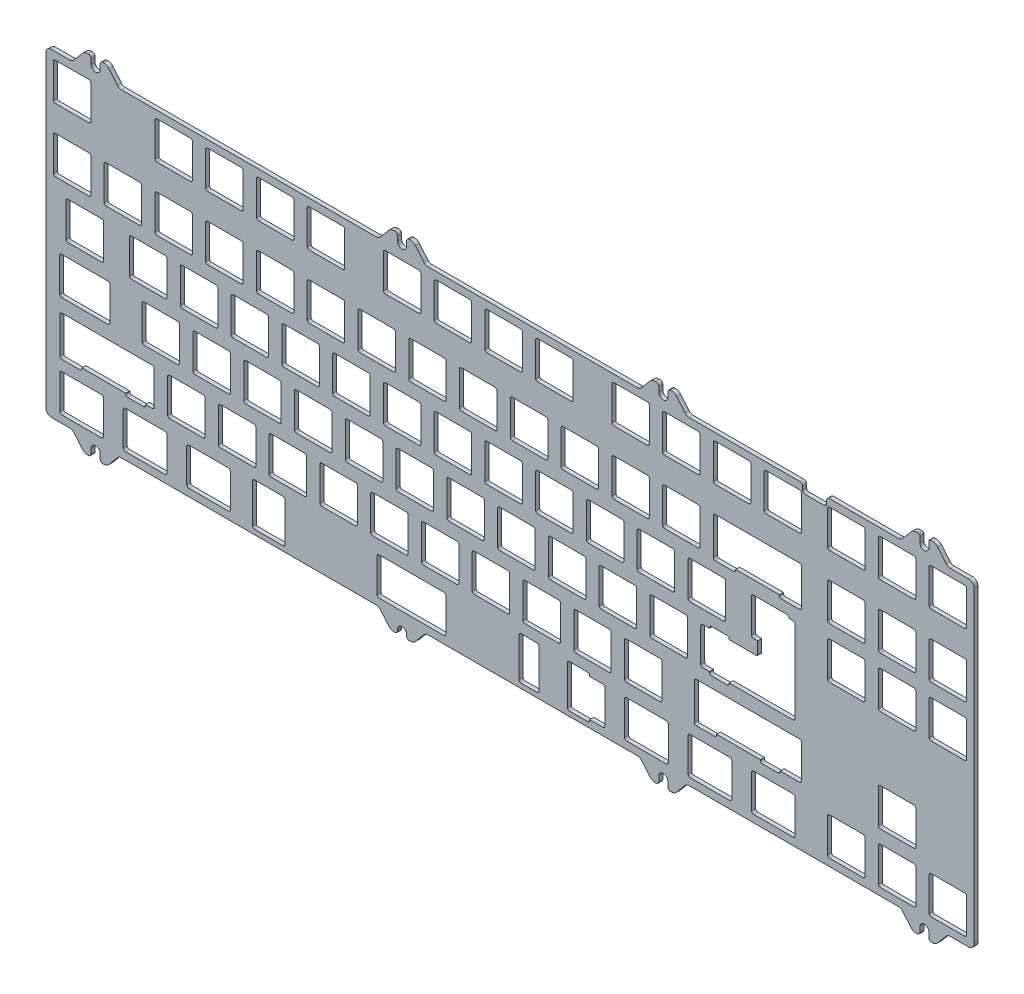
from build123d import *

# Parameters (mm, degrees)
EXTRUDE_1_DEPTH = 1.5


with BuildPart() as part:
    # 스케치1 → 보스-돌출1 (new body)
    with BuildSketch(Plane.XY):
        with BuildLine():
            Line((231.532778374, -109.812504455), (310.071896545, -109.812504455))
            ThreePointArc((310.071896545, -109.812504455), (310.917129792, -109.999890341), (311.603979435, -110.526929506))
            Line((311.603979435, -110.526929506), (314.786296701, -114.319471173))
            ThreePointArc((314.786296701, -114.319471173), (315.644863565, -114.978274877), (316.701412124, -115.212506643))
            Line((316.701412124, -115.212506643), (317.079660645, -115.212506643))
            ThreePointArc((317.079660645, -115.212506643), (317.786768112, -114.919612822), (318.079660846, -114.212504904))
            Line((318.079660846, -114.212504904), (318.079660846, -112.412504237))
            ThreePointArc((318.079660846, -112.412504237), (319.77965982, -110.712506364), (321.479658795, -112.412504237))
            Line((321.479658795, -112.412504237), (321.479660444, -114.212506442))
            ThreePointArc((321.479660444, -114.212506442), (321.772553662, -114.919613223), (322.479660444, -115.212506442))
            Line((322.479660444, -115.212506442), (322.857908964, -115.212506442))
            ThreePointArc((322.857908964, -115.212506442), (323.914454618, -114.97827591), (324.773020072, -114.319475466))
            Line((324.773020072, -114.319475466), (327.955342548, -110.526931223))
            ThreePointArc((327.955342548, -110.526931223), (328.64219491, -109.999890868), (329.487431434, -109.812506442))
            Line((329.487431434, -109.812506442), (336.412510444, -109.812506442))
            ThreePointArc((336.412510444, -109.812506442), (337.82672103, -109.226721627), (338.412507177, -107.812511592))
            Line((338.412507177, -107.812511592), (338.412507177, 7.799989687))
            ThreePointArc((338.412507177, 7.799989687), (337.826723914, 9.214210914), (336.412504524, 9.799998613))
            Line((336.412504524, 9.799998613), (329.487425514, 9.799998613))
            ThreePointArc((329.487425514, 9.799998613), (328.642188991, 9.987383039), (327.955336628, 10.514423393))
            Line((327.955336628, 10.514423393), (324.773014152, 14.306967637))
            ThreePointArc((324.773014152, 14.306967637), (323.914448699, 14.96576808), (322.857903044, 15.199998613))
            Line((322.857903044, 15.199998613), (321.979654524, 15.199998613))
            ThreePointArc((321.979654524, 15.199998613), (321.626100422, 15.053551634), (321.4796537, 14.699997425))
            Line((321.4796537, 14.699997425), (321.4796537, 12.399997607))
            ThreePointArc((321.4796537, 12.399997607), (319.779654725, 10.699171768), (318.07965575, 12.399997606))
            Line((318.07965575, 12.399997606), (318.07965575, 14.699997424))
            ThreePointArc((318.07965575, 14.699997424), (317.933211586, 15.053548674), (317.579662328, 15.199997647))
            Line((317.579662328, 15.199997647), (316.701406969, 15.199997929))
            ThreePointArc((316.701406969, 15.199997929), (315.644861314, 14.965767396), (314.786295861, 14.306966953))
            Line((314.786295861, 14.306966953), (311.603973385, 10.514422709))
            ThreePointArc((311.603973385, 10.514422709), (310.91712393, 9.987383689), (310.071890913, 9.799997853))
            Line((310.071890913, 9.799997853), (284.106259905, 9.799997853))
            ThreePointArc((284.106259905, 9.799997853), (283.399150314, 9.507106315), (283.106255538, 8.799998064))
            Line((283.106255538, 8.799998064), (283.106255538, 7.599998064))
            ThreePointArc((283.106255538, 7.599998064), (282.813362441, 6.892891586), (282.106256063, 6.599998246))
            Line((282.106256063, 6.599998246), (275.106256778, 6.599998246))
            ThreePointArc((275.106256778, 6.599998246), (274.39914926, 6.892891), (274.106255629, 7.599998155))
            Line((274.106255629, 7.599998155), (274.106255629, 8.799998155))
            ThreePointArc((274.106255629, 8.799998155), (273.813361477, 9.507105782), (273.106253027, 9.799997944))
            Line((273.106253027, 9.799997944), (231.532773255, 9.799997944))
            ThreePointArc((231.532773255, 9.799997944), (230.687538598, 9.987383145), (230.000687783, 10.5144228))
            Line((230.000687783, 10.5144228), (226.818365307, 14.306967044))
            ThreePointArc((226.818365307, 14.306967044), (225.959799853, 14.965767487), (224.903254199, 15.19999802))
            Line((224.903254199, 15.19999802), (224.525005678, 15.19999802))
            ThreePointArc((224.525005678, 15.19999802), (223.817898897, 14.907104801), (223.525005678, 14.19999802))
            Line((223.525005678, 14.19999802), (223.525008277, 12.399997838))
            ThreePointArc((223.525008277, 12.399997838), (221.825009302, 10.699999045), (220.125010328, 12.399997838))
            Line((220.125010328, 12.399997838), (220.125005678, 14.19999802))
            ThreePointArc((220.125005678, 14.19999802), (219.832113428, 14.907103774), (219.125008442, 15.199997879))
            Line((219.125008442, 15.199997879), (218.746757366, 15.199997879))
            ThreePointArc((218.746757366, 15.199997879), (217.690211712, 14.965767488), (216.831646191, 14.306967185))
            Line((216.831646191, 14.306967185), (213.649323715, 10.514422941))
            ThreePointArc((213.649323715, 10.514422941), (212.962469432, 9.987381669), (212.117230589, 9.799998085))
            Line((212.117230589, 9.799998085), (133.532783086, 9.799998085))
            ThreePointArc((133.532783086, 9.799998085), (132.687542953, 9.98738117), (132.0006876, 10.514422941))
            Line((132.0006876, 10.514422941), (128.818365124, 14.306967185))
            ThreePointArc((128.818365124, 14.306967185), (127.959800758, 14.965767106), (126.903256418, 15.19999811))
            Line((126.903256418, 15.19999811), (126.525005604, 15.199998392))
            ThreePointArc((126.525005604, 15.199998392), (125.817897856, 14.90710468), (125.52500446, 14.199996802))
            Line((125.52500446, 14.199996802), (125.525006749, 12.399997247))
            ThreePointArc((125.525006749, 12.399997247), (123.825006749, 10.699997247), (122.125006749, 12.399997247))
            Line((122.125006749, 12.399997247), (122.12500651, 14.199996802))
            ThreePointArc((122.12500651, 14.199996802), (121.832112774, 14.907104488), (121.125004624, 15.199997107))
            Line((121.125004624, 15.199997107), (120.746758369, 15.199997388))
            ThreePointArc((120.746758369, 15.199997388), (119.690212715, 14.965766856), (118.831647261, 14.306966412))
            Line((118.831647261, 14.306966412), (115.649324785, 10.514422169))
            ThreePointArc((115.649324785, 10.514422169), (114.962471664, 9.987381438), (114.117234223, 9.799997313))
            Line((114.117234223, 9.799997313), (18.540612817, 9.799997313))
            ThreePointArc((18.540612817, 9.799997313), (17.695376293, 9.987381739), (17.008523931, 10.514422093))
            Line((17.008523931, 10.514422093), (13.826201878, 14.306966716))
            ThreePointArc((13.826201878, 14.306966716), (12.967636378, 14.965766936), (11.91109078, 15.199997263))
            Line((11.91109078, 15.199997263), (11.532841567, 15.199997263))
            ThreePointArc((11.532841567, 15.199997263), (10.825735107, 14.907103914), (10.532842134, 14.199997298))
            Line((10.532842134, 14.199997298), (10.532841735, 12.399997744))
            ThreePointArc((10.532841735, 12.399997744), (8.832841886, 10.699542788), (7.132841856, 12.399997562))
            Line((7.132841856, 12.399997562), (7.132841856, 14.199997298))
            ThreePointArc((7.132841856, 14.199997298), (6.839948752, 14.907104411), (6.132841735, 15.199997744))
            Line((6.132841735, 15.199997744), (5.754593411, 15.199997462))
            ThreePointArc((5.754593411, 15.199997462), (4.698047686, 14.965767099), (3.839482107, 14.306966768))
            Line((3.839482107, 14.306966768), (0.657159631, 10.514422525))
            ThreePointArc((0.657159631, 10.514422525), (-0.029692672, 9.987381941), (-0.874929246, 9.799997322))
            Line((-0.874929246, 9.799997322), (-7.800008054, 9.799997322))
            ThreePointArc((-7.800008054, 9.799997322), (-9.214221604, 9.214211109), (-9.800008265, 7.799997744))
            Line((-9.800008265, 7.799997744), (-9.800008265, -107.812503353))
            ThreePointArc((-9.800008265, -107.812503353), (-9.214221292, -109.226715278), (-7.800008753, -109.81250077))
            Line((-7.800008753, -109.81250077), (-0.874929954, -109.812502284))
            ThreePointArc((-0.874929954, -109.812502284), (-0.029693431, -109.99988671), (0.657158932, -110.526927065))
            Line((0.657158932, -110.526927065), (3.839481408, -114.319471309))
            ThreePointArc((3.839481408, -114.319471309), (4.698046885, -114.978272061), (5.754592712, -115.212502773))
            Line((5.754592712, -115.212502773), (6.132840994, -115.212502773))
            ThreePointArc((6.132840994, -115.212502773), (6.839947975, -114.919609396), (7.132841036, -114.212502284))
            Line((7.132841036, -114.212502284), (7.132841158, -112.412500079))
            ThreePointArc((7.132841158, -112.412500079), (8.832841297, -110.712501033), (10.532841435, -112.412500079))
            Line((10.532841435, -112.412500079), (10.532841435, -114.212500747))
            ThreePointArc((10.532841435, -114.212500747), (10.825733749, -114.919608566), (11.532840868, -115.212502573))
            Line((11.532840868, -115.212502573), (11.911090081, -115.212502573))
            ThreePointArc((11.911090081, -115.212502573), (12.967636359, -114.978271339), (13.826201797, -114.319469626))
            Line((13.826201797, -114.319469626), (17.00852385, -110.526927959))
            ThreePointArc((17.00852385, -110.526927959), (17.695376388, -109.999887444), (18.540613129, -109.812502908))
            Line((18.540613129, -109.812502908), (114.117234721, -109.812502908))
            ThreePointArc((114.117234721, -109.812502908), (114.962472393, -109.999887085), (115.649325702, -110.526927959))
            Line((115.649325702, -110.526927959), (118.831649779, -114.319469626))
            ThreePointArc((118.831649779, -114.319469626), (119.690216192, -114.978270834), (120.746763207, -115.212500898))
            Line((120.746763207, -115.212500898), (121.125006833, -115.212500898))
            ThreePointArc((121.125006833, -115.212500898), (121.83211571, -114.9196079), (122.125009223, -114.212499235))
            Line((122.125009223, -114.212499235), (122.125009461, -113.712500773))
            ThreePointArc((122.125009461, -113.712500773), (123.825009461, -112.012500773), (125.525009461, -113.712500773))
            Line((125.525009461, -113.712500773), (125.525007172, -114.212499235))
            ThreePointArc((125.525007172, -114.212499235), (125.817899917, -114.919608043), (126.525008055, -115.212502406))
            Line((126.525008055, -115.212502406), (126.90325913, -115.212502406))
            ThreePointArc((126.90325913, -115.212502406), (127.959805684, -114.978270456), (128.818371114, -114.319468036))
            Line((128.818371114, -114.319468036), (132.000690267, -110.526926369))
            ThreePointArc((132.000690267, -110.526926369), (132.687545808, -109.999884454), (133.532786172, -109.812501318))
            Line((133.532786172, -109.812501318), (212.117233675, -109.812501318))
            ThreePointArc((212.117233675, -109.812501318), (212.962472748, -109.999884953), (213.649327219, -110.526926369))
            Line((213.649327219, -110.526926369), (216.831648732, -114.319468036))
            ThreePointArc((216.831648732, -114.319468036), (217.690214485, -114.978270078), (218.746761222, -115.212501323))
            Line((218.746761222, -115.212501323), (219.125012297, -115.212501323))
            ThreePointArc((219.125012297, -115.212501323), (219.832119743, -114.91960588), (220.125012244, -114.212497216))
            Line((220.125012244, -114.212497216), (220.125012244, -112.412496548))
            ThreePointArc((220.125012244, -112.412496548), (221.825011219, -110.712499779), (223.525010193, -112.412496548))
            Line((223.525010193, -112.412496548), (223.525007595, -114.212498754))
            ThreePointArc((223.525007595, -114.212498754), (223.817900813, -114.919605535), (224.525007595, -115.212498754))
            Line((224.525007595, -115.212498754), (224.903263296, -115.212499242))
            ThreePointArc((224.903263296, -115.212499242), (225.959802639, -114.978267979), (226.818363317, -114.319471173))
            Line((226.818363317, -114.319471173), (230.000692483, -110.526929506))
            ThreePointArc((230.000692483, -110.526929506), (230.687543486, -109.999889707), (231.532778374, -109.812504455))
        make_face()
        with BuildLine():
            Line((241.33, -16.7825), (273.02, -16.7825))
            ThreePointArc((273.02, -16.7825), (273.514974747, -16.987525253), (273.72, -17.4825))
            Line((273.72, -17.4825), (273.72, -31.1325))
            ThreePointArc((273.72, -31.1325), (273.514974747, -31.627474747), (273.02, -31.8325))
            Line((273.02, -31.8325), (266.11305, -31.8325))
            ThreePointArc((266.11305, -31.8325), (265.618075253, -31.627474747), (265.41305, -31.1325))
            Line((265.41305, -31.1325), (265.41305, -30.8325))
            Line((265.41305, -30.8325), (248.93695, -30.8325))
            Line((248.93695, -30.8325), (248.93695, -31.1325))
            ThreePointArc((248.93695, -31.1325), (248.731924747, -31.627474747), (248.23695, -31.8325))
            Line((248.23695, -31.8325), (241.33, -31.8325))
            ThreePointArc((241.33, -31.8325), (240.835025253, -31.627474747), (240.63, -31.1325))
            Line((240.63, -31.1325), (240.63, -17.4825))
            ThreePointArc((240.63, -17.4825), (240.835025253, -16.987525253), (241.33, -16.7825))
        make_face(mode=Mode.SUBTRACT)
        with BuildLine():
            Line((234.28625, -73.9325), (272.92, -73.9325))
            ThreePointArc((272.92, -73.9325), (273.485685425, -74.166814575), (273.72, -74.7325))
            Line((273.72, -74.7325), (273.72, -87.1825))
            ThreePointArc((273.72, -87.1825), (273.485685425, -87.748185425), (272.92, -87.9825))
            Line((272.92, -87.9825), (265.6692, -87.9825))
            Line((265.6692, -87.9825), (265.6692, -88.2925))
            ThreePointArc((265.6692, -88.2925), (265.464174747, -88.787474747), (264.9692, -88.9925))
            Line((264.9692, -88.9925), (258.9693, -88.9925))
            ThreePointArc((258.9693, -88.9925), (258.474325253, -88.787474747), (258.2693, -88.2925))
            Line((258.2693, -88.2925), (258.2693, -87.9925))
            Line((258.2693, -87.9925), (241.7932, -87.9925))
            Line((241.7932, -87.9925), (241.7932, -88.2925))
            ThreePointArc((241.7932, -88.2925), (241.588174747, -88.787474747), (241.0932, -88.9925))
            Line((241.0932, -88.9925), (234.18625, -88.9925))
            ThreePointArc((234.18625, -88.9925), (233.691275253, -88.787474747), (233.48625, -88.2925))
            Line((233.48625, -88.2925), (233.48625, -74.7325))
            ThreePointArc((233.48625, -74.7325), (233.720564575, -74.166814575), (234.28625, -73.9325))
        make_face(mode=Mode.SUBTRACT)
        with BuildLine():
            Line((255.7175, -92.9925), (270.538801687, -92.9925))
            ThreePointArc((270.538801687, -92.9925), (271.104487112, -93.226814575), (271.338801687, -93.7925))
            Line((271.338801687, -93.7925), (271.338801687, -106.2325))
            ThreePointArc((271.338801687, -106.2325), (271.104487112, -106.798185425), (270.538801687, -107.0325))
            Line((270.538801687, -107.0325), (255.7175, -107.0325))
            ThreePointArc((255.7175, -107.0325), (255.151814575, -106.798185425), (254.9175, -106.2325))
            Line((254.9175, -106.2325), (254.9175, -93.7925))
            ThreePointArc((254.9175, -93.7925), (255.151814575, -93.226814575), (255.7175, -92.9925))
        make_face(mode=Mode.SUBTRACT)
        with BuildLine():
            Line((260.37, -7.03), (273.03, -7.03))
            ThreePointArc((273.03, -7.03), (273.524974747, -6.824974747), (273.73, -6.33))
            Line((273.73, -6.33), (273.73, 6.33))
            ThreePointArc((273.73, 6.33), (273.524974747, 6.824974747), (273.03, 7.03))
            Line((273.03, 7.03), (260.37, 7.03))
            ThreePointArc((260.37, 7.03), (259.875025253, 6.824974747), (259.67, 6.33))
            Line((259.67, 6.33), (259.67, -6.33))
            ThreePointArc((259.67, -6.33), (259.875025253, -6.824974747), (260.37, -7.03))
        make_face(mode=Mode.SUBTRACT)
        with BuildLine():
            Line((246.5557, -68.9425), (270.538801687, -68.9425))
            ThreePointArc((270.538801687, -68.9425), (271.104487112, -68.708185425), (271.338801687, -68.1425))
            Line((271.338801687, -68.1425), (271.338801687, -37.5495))
            ThreePointArc((271.338801687, -37.5495), (271.104487112, -36.983814575), (270.538801687, -36.7495))
            Line((270.538801687, -36.7495), (268.9675, -36.7495))
            Line((268.9675, -36.7495), (268.9675, -36.5325))
            ThreePointArc((268.9675, -36.5325), (268.762474747, -36.037525253), (268.2675, -35.8325))
            Line((268.2675, -35.8325), (255.6075, -35.8325))
            ThreePointArc((255.6075, -35.8325), (255.112525253, -36.037525253), (254.9075, -36.5325))
            Line((254.9075, -36.5325), (254.9075, -49.1925))
            ThreePointArc((254.9075, -49.1925), (255.112525253, -49.687474747), (255.6075, -49.8925))
            Line((255.6075, -49.8925), (257.267, -49.8925))
            Line((257.267, -49.8925), (257.267, -54.3825))
            ThreePointArc((257.267, -54.3825), (257.120553391, -54.736053391), (256.767, -54.8825))
            Line((256.767, -54.8825), (246.5557, -54.8825))
            Line((246.5557, -54.8825), (246.5557, -54.5825))
            ThreePointArc((246.5557, -54.5825), (246.350674747, -54.087525253), (245.8557, -53.8825))
            Line((245.8557, -53.8825), (239.8558, -53.8825))
            ThreePointArc((239.8558, -53.8825), (239.360825253, -54.087525253), (239.1558, -54.5825))
            Line((239.1558, -54.5825), (239.1558, -54.8825))
            Line((239.1558, -54.8825), (236.6675, -54.8825))
            ThreePointArc((236.6675, -54.8825), (236.101814575, -55.116814575), (235.8675, -55.6825))
            Line((235.8675, -55.6825), (235.8675, -68.1425))
            ThreePointArc((235.8675, -68.1425), (236.101814575, -68.708185425), (236.6675, -68.9425))
            Line((236.6675, -68.9425), (239.1558, -68.9425))
            Line((239.1558, -68.9425), (239.1558, -69.2425))
            ThreePointArc((239.1558, -69.2425), (239.360825253, -69.737474747), (239.8558, -69.9425))
            Line((239.8558, -69.9425), (245.8557, -69.9425))
            ThreePointArc((245.8557, -69.9425), (246.350674747, -69.737474747), (246.5557, -69.2425))
            Line((246.5557, -69.2425), (246.5557, -68.9425))
        make_face(mode=Mode.SUBTRACT)
        with BuildLine():
            Line((27.0075, -68.9425), (39.6675, -68.9425))
            ThreePointArc((39.6675, -68.9425), (40.162474747, -68.737474747), (40.3675, -68.2425))
            Line((40.3675, -68.2425), (40.3675, -55.5825))
            ThreePointArc((40.3675, -55.5825), (40.162474747, -55.087525253), (39.6675, -54.8825))
            Line((39.6675, -54.8825), (27.0075, -54.8825))
            ThreePointArc((27.0075, -54.8825), (26.512525253, -55.087525253), (26.3075, -55.5825))
            Line((26.3075, -55.5825), (26.3075, -68.2425))
            ThreePointArc((26.3075, -68.2425), (26.512525253, -68.737474747), (27.0075, -68.9425))
        make_face(mode=Mode.SUBTRACT)
        with BuildLine():
            Line((31.77, -30.8425), (44.43, -30.8425))
            ThreePointArc((44.43, -30.8425), (44.924974747, -30.637474747), (45.13, -30.1425))
            Line((45.13, -30.1425), (45.13, -17.4825))
            ThreePointArc((45.13, -17.4825), (44.924974747, -16.987525253), (44.43, -16.7825))
            Line((44.43, -16.7825), (31.77, -16.7825))
            ThreePointArc((31.77, -16.7825), (31.275025253, -16.987525253), (31.07, -17.4825))
            Line((31.07, -17.4825), (31.07, -30.1425))
            ThreePointArc((31.07, -30.1425), (31.275025253, -30.637474747), (31.77, -30.8425))
        make_face(mode=Mode.SUBTRACT)
        with BuildLine():
            Line((31.77, -7.03), (44.43, -7.03))
            ThreePointArc((44.43, -7.03), (44.924974747, -6.824974747), (45.13, -6.33))
            Line((45.13, -6.33), (45.13, 6.33))
            ThreePointArc((45.13, 6.33), (44.924974747, 6.824974747), (44.43, 7.03))
            Line((44.43, 7.03), (31.77, 7.03))
            ThreePointArc((31.77, 7.03), (31.275025253, 6.824974747), (31.07, 6.33))
            Line((31.07, 6.33), (31.07, -6.33))
            ThreePointArc((31.07, -6.33), (31.275025253, -6.824974747), (31.77, -7.03))
        make_face(mode=Mode.SUBTRACT)
        with BuildLine():
            Line((12.02, -17.4825), (12.02, -30.1425))
            ThreePointArc((12.02, -30.1425), (12.225025253, -30.637474747), (12.72, -30.8425))
            Line((12.72, -30.8425), (25.38, -30.8425))
            ThreePointArc((25.38, -30.8425), (25.874974747, -30.637474747), (26.08, -30.1425))
            Line((26.08, -30.1425), (26.08, -17.4825))
            ThreePointArc((26.08, -17.4825), (25.874974747, -16.987525253), (25.38, -16.7825))
            Line((25.38, -16.7825), (12.72, -16.7825))
            ThreePointArc((12.72, -16.7825), (12.225025253, -16.987525253), (12.02, -17.4825))
        make_face(mode=Mode.SUBTRACT)
        with BuildLine():
            Line((-7.03, -17.4825), (-7.03, -30.1425))
            ThreePointArc((-7.03, -30.1425), (-6.824974747, -30.637474747), (-6.33, -30.8425))
            Line((-6.33, -30.8425), (6.33, -30.8425))
            ThreePointArc((6.33, -30.8425), (6.824974747, -30.637474747), (7.03, -30.1425))
            Line((7.03, -30.1425), (7.03, -17.4825))
            ThreePointArc((7.03, -17.4825), (6.824974747, -16.987525253), (6.33, -16.7825))
            Line((6.33, -16.7825), (-6.33, -16.7825))
            ThreePointArc((-6.33, -16.7825), (-6.824974747, -16.987525253), (-7.03, -17.4825))
        make_face(mode=Mode.SUBTRACT)
        with BuildLine():
            Line((30.812492594, -87.1825), (30.812492594, -74.6325))
            ThreePointArc((30.812492594, -74.6325), (30.607467341, -74.137525253), (30.112492594, -73.9325))
            Line((30.112492594, -73.9325), (-3.918756939, -73.9325))
            ThreePointArc((-3.918756939, -73.9325), (-4.413731686, -74.137525253), (-4.618756939, -74.6325))
            Line((-4.618756939, -74.6325), (-4.618756939, -88.2925))
            ThreePointArc((-4.618756939, -88.2925), (-4.413731686, -88.787474747), (-3.918756939, -88.9925))
            Line((-3.918756939, -88.9925), (2.968357798, -88.9925))
            ThreePointArc((2.968357798, -88.9925), (3.463462784, -88.787344473), (3.668357701, -88.292131579))
            Line((3.668357701, -88.292131579), (3.6682, -87.9925))
            Line((3.6682, -87.9925), (20.1443, -87.9925))
            Line((20.1443, -87.9925), (20.144142299, -88.292131579))
            ThreePointArc((20.144142299, -88.292131579), (20.349037216, -88.787344473), (20.844142202, -88.9925))
            Line((20.844142202, -88.9925), (26.8442, -88.9925))
            ThreePointArc((26.8442, -88.9925), (27.339174747, -88.787474747), (27.5442, -88.2925))
            Line((27.5442, -88.2925), (27.5442, -87.9825))
            Line((27.5442, -87.9825), (30.012492594, -87.9825))
            ThreePointArc((30.012492594, -87.9825), (30.578178019, -87.748185425), (30.812492594, -87.1825))
        make_face(mode=Mode.SUBTRACT)
        with BuildLine():
            Line((35.8325, -74.6325), (35.8325, -87.2925))
            ThreePointArc((35.8325, -87.2925), (36.037525253, -87.787474747), (36.5325, -87.9925))
            Line((36.5325, -87.9925), (49.1925, -87.9925))
            ThreePointArc((49.1925, -87.9925), (49.687474747, -87.787474747), (49.8925, -87.2925))
            Line((49.8925, -87.2925), (49.8925, -74.6325))
            ThreePointArc((49.8925, -74.6325), (49.687474747, -74.137525253), (49.1925, -73.9325))
            Line((49.1925, -73.9325), (36.5325, -73.9325))
            ThreePointArc((36.5325, -73.9325), (36.037525253, -74.137525253), (35.8325, -74.6325))
        make_face(mode=Mode.SUBTRACT)
        with BuildLine():
            Line((-3.838698313, -92.9925), (10.9825, -92.9925))
            ThreePointArc((10.9825, -92.9925), (11.548185425, -93.226814575), (11.7825, -93.7925))
            Line((11.7825, -93.7925), (11.7825, -106.2325))
            ThreePointArc((11.7825, -106.2325), (11.548185425, -106.798185425), (10.9825, -107.0325))
            Line((10.9825, -107.0325), (-3.838698313, -107.0325))
            ThreePointArc((-3.838698313, -107.0325), (-4.404383738, -106.798185425), (-4.638698313, -106.2325))
            Line((-4.638698313, -106.2325), (-4.638698313, -93.7925))
            ThreePointArc((-4.638698313, -93.7925), (-4.404383738, -93.226814575), (-3.838698313, -92.9925))
        make_face(mode=Mode.SUBTRACT)
        with BuildLine():
            Line((19.973801687, -92.9925), (34.795, -92.9925))
            ThreePointArc((34.795, -92.9925), (35.360685425, -93.226814575), (35.595, -93.7925))
            Line((35.595, -93.7925), (35.595, -106.2325))
            ThreePointArc((35.595, -106.2325), (35.360685425, -106.798185425), (34.795, -107.0325))
            Line((34.795, -107.0325), (19.973801687, -107.0325))
            ThreePointArc((19.973801687, -107.0325), (19.408116262, -106.798185425), (19.173801687, -106.2325))
            Line((19.173801687, -106.2325), (19.173801687, -93.7925))
            ThreePointArc((19.173801687, -93.7925), (19.408116262, -93.226814575), (19.973801687, -92.9925))
        make_face(mode=Mode.SUBTRACT)
        with BuildLine():
            Line((-3.94875, -68.9425), (13.47375, -68.9425))
            ThreePointArc((13.47375, -68.9425), (13.968724747, -68.737474747), (14.17375, -68.2425))
            Line((14.17375, -68.2425), (14.17375, -55.5825))
            ThreePointArc((14.17375, -55.5825), (13.968724747, -55.087525253), (13.47375, -54.8825))
            Line((13.47375, -54.8825), (-3.94875, -54.8825))
            ThreePointArc((-3.94875, -54.8825), (-4.443724747, -55.087525253), (-4.64875, -55.5825))
            Line((-4.64875, -55.5825), (-4.64875, -68.2425))
            ThreePointArc((-4.64875, -68.2425), (-4.443724747, -68.737474747), (-3.94875, -68.9425))
        make_face(mode=Mode.SUBTRACT)
        with BuildLine():
            Line((-1.5675, -49.8925), (11.0925, -49.8925))
            ThreePointArc((11.0925, -49.8925), (11.587474747, -49.687474747), (11.7925, -49.1925))
            Line((11.7925, -49.1925), (11.7925, -36.5325))
            ThreePointArc((11.7925, -36.5325), (11.587474747, -36.037525253), (11.0925, -35.8325))
            Line((11.0925, -35.8325), (-1.5675, -35.8325))
            ThreePointArc((-1.5675, -35.8325), (-2.062474747, -36.037525253), (-2.2675, -36.5325))
            Line((-2.2675, -36.5325), (-2.2675, -49.1925))
            ThreePointArc((-2.2675, -49.1925), (-2.062474747, -49.687474747), (-1.5675, -49.8925))
        make_face(mode=Mode.SUBTRACT)
        with BuildLine():
            Line((21.545, -36.5325), (21.545, -49.1925))
            ThreePointArc((21.545, -49.1925), (21.750025253, -49.687474747), (22.245, -49.8925))
            Line((22.245, -49.8925), (34.905, -49.8925))
            ThreePointArc((34.905, -49.8925), (35.399974747, -49.687474747), (35.605, -49.1925))
            Line((35.605, -49.1925), (35.605, -36.5325))
            ThreePointArc((35.605, -36.5325), (35.399974747, -36.037525253), (34.905, -35.8325))
            Line((34.905, -35.8325), (22.245, -35.8325))
            ThreePointArc((22.245, -35.8325), (21.750025253, -36.037525253), (21.545, -36.5325))
        make_face(mode=Mode.SUBTRACT)
        with BuildLine():
            Line((-7.03, 6.33), (-7.03, -6.33))
            ThreePointArc((-7.03, -6.33), (-6.824974747, -6.824974747), (-6.33, -7.03))
            Line((-6.33, -7.03), (6.33, -7.03))
            ThreePointArc((6.33, -7.03), (6.824974747, -6.824974747), (7.03, -6.33))
            Line((7.03, -6.33), (7.03, 6.33))
            ThreePointArc((7.03, 6.33), (6.824974747, 6.824974747), (6.33, 7.03))
            Line((6.33, 7.03), (-6.33, 7.03))
            ThreePointArc((-6.33, 7.03), (-6.824974747, 6.824974747), (-7.03, 6.33))
        make_face(mode=Mode.SUBTRACT)
        with BuildLine():
            Line((221.57, -17.4825), (221.57, -30.1425))
            ThreePointArc((221.57, -30.1425), (221.775025253, -30.637474747), (222.27, -30.8425))
            Line((222.27, -30.8425), (234.93, -30.8425))
            ThreePointArc((234.93, -30.8425), (235.424974747, -30.637474747), (235.63, -30.1425))
            Line((235.63, -30.1425), (235.63, -17.4825))
            ThreePointArc((235.63, -17.4825), (235.424974747, -16.987525253), (234.93, -16.7825))
            Line((234.93, -16.7825), (222.27, -16.7825))
            ThreePointArc((222.27, -16.7825), (221.775025253, -16.987525253), (221.57, -17.4825))
        make_face(mode=Mode.SUBTRACT)
        with BuildLine():
            Line((202.52, -17.4825), (202.52, -30.1425))
            ThreePointArc((202.52, -30.1425), (202.725025253, -30.637474747), (203.22, -30.8425))
            Line((203.22, -30.8425), (215.88, -30.8425))
            ThreePointArc((215.88, -30.8425), (216.374974747, -30.637474747), (216.58, -30.1425))
            Line((216.58, -30.1425), (216.58, -17.4825))
            ThreePointArc((216.58, -17.4825), (216.374974747, -16.987525253), (215.88, -16.7825))
            Line((215.88, -16.7825), (203.22, -16.7825))
            ThreePointArc((203.22, -16.7825), (202.725025253, -16.987525253), (202.52, -17.4825))
        make_face(mode=Mode.SUBTRACT)
        with BuildLine():
            Line((183.47, -17.4825), (183.47, -30.1425))
            ThreePointArc((183.47, -30.1425), (183.675025253, -30.637474747), (184.17, -30.8425))
            Line((184.17, -30.8425), (196.83, -30.8425))
            ThreePointArc((196.83, -30.8425), (197.324974747, -30.637474747), (197.53, -30.1425))
            Line((197.53, -30.1425), (197.53, -17.4825))
            ThreePointArc((197.53, -17.4825), (197.324974747, -16.987525253), (196.83, -16.7825))
            Line((196.83, -16.7825), (184.17, -16.7825))
            ThreePointArc((184.17, -16.7825), (183.675025253, -16.987525253), (183.47, -17.4825))
        make_face(mode=Mode.SUBTRACT)
        with BuildLine():
            Line((164.42, -17.4825), (164.42, -30.1425))
            ThreePointArc((164.42, -30.1425), (164.625025253, -30.637474747), (165.12, -30.8425))
            Line((165.12, -30.8425), (177.78, -30.8425))
            ThreePointArc((177.78, -30.8425), (178.274974747, -30.637474747), (178.48, -30.1425))
            Line((178.48, -30.1425), (178.48, -17.4825))
            ThreePointArc((178.48, -17.4825), (178.274974747, -16.987525253), (177.78, -16.7825))
            Line((177.78, -16.7825), (165.12, -16.7825))
            ThreePointArc((165.12, -16.7825), (164.625025253, -16.987525253), (164.42, -17.4825))
        make_face(mode=Mode.SUBTRACT)
        with BuildLine():
            Line((145.37, -17.4825), (145.37, -30.1425))
            ThreePointArc((145.37, -30.1425), (145.575025253, -30.637474747), (146.07, -30.8425))
            Line((146.07, -30.8425), (158.73, -30.8425))
            ThreePointArc((158.73, -30.8425), (159.224974747, -30.637474747), (159.43, -30.1425))
            Line((159.43, -30.1425), (159.43, -17.4825))
            ThreePointArc((159.43, -17.4825), (159.224974747, -16.987525253), (158.73, -16.7825))
            Line((158.73, -16.7825), (146.07, -16.7825))
            ThreePointArc((146.07, -16.7825), (145.575025253, -16.987525253), (145.37, -17.4825))
        make_face(mode=Mode.SUBTRACT)
        with BuildLine():
            Line((126.32, -17.4825), (126.32, -30.1425))
            ThreePointArc((126.32, -30.1425), (126.525025253, -30.637474747), (127.02, -30.8425))
            Line((127.02, -30.8425), (139.68, -30.8425))
            ThreePointArc((139.68, -30.8425), (140.174974747, -30.637474747), (140.38, -30.1425))
            Line((140.38, -30.1425), (140.38, -17.4825))
            ThreePointArc((140.38, -17.4825), (140.174974747, -16.987525253), (139.68, -16.7825))
            Line((139.68, -16.7825), (127.02, -16.7825))
            ThreePointArc((127.02, -16.7825), (126.525025253, -16.987525253), (126.32, -17.4825))
        make_face(mode=Mode.SUBTRACT)
        with BuildLine():
            Line((107.27, -17.4825), (107.27, -30.1425))
            ThreePointArc((107.27, -30.1425), (107.475025253, -30.637474747), (107.97, -30.8425))
            Line((107.97, -30.8425), (120.63, -30.8425))
            ThreePointArc((120.63, -30.8425), (121.124974747, -30.637474747), (121.33, -30.1425))
            Line((121.33, -30.1425), (121.33, -17.4825))
            ThreePointArc((121.33, -17.4825), (121.124974747, -16.987525253), (120.63, -16.7825))
            Line((120.63, -16.7825), (107.97, -16.7825))
            ThreePointArc((107.97, -16.7825), (107.475025253, -16.987525253), (107.27, -17.4825))
        make_face(mode=Mode.SUBTRACT)
        with BuildLine():
            Line((88.22, -17.4825), (88.22, -30.1425))
            ThreePointArc((88.22, -30.1425), (88.425025253, -30.637474747), (88.92, -30.8425))
            Line((88.92, -30.8425), (101.58, -30.8425))
            ThreePointArc((101.58, -30.8425), (102.074974747, -30.637474747), (102.28, -30.1425))
            Line((102.28, -30.1425), (102.28, -17.4825))
            ThreePointArc((102.28, -17.4825), (102.074974747, -16.987525253), (101.58, -16.7825))
            Line((101.58, -16.7825), (88.92, -16.7825))
            ThreePointArc((88.92, -16.7825), (88.425025253, -16.987525253), (88.22, -17.4825))
        make_face(mode=Mode.SUBTRACT)
        with BuildLine():
            Line((69.17, -17.4825), (69.17, -30.1425))
            ThreePointArc((69.17, -30.1425), (69.375025253, -30.637474747), (69.87, -30.8425))
            Line((69.87, -30.8425), (82.53, -30.8425))
            ThreePointArc((82.53, -30.8425), (83.024974747, -30.637474747), (83.23, -30.1425))
            Line((83.23, -30.1425), (83.23, -17.4825))
            ThreePointArc((83.23, -17.4825), (83.024974747, -16.987525253), (82.53, -16.7825))
            Line((82.53, -16.7825), (69.87, -16.7825))
            ThreePointArc((69.87, -16.7825), (69.375025253, -16.987525253), (69.17, -17.4825))
        make_face(mode=Mode.SUBTRACT)
        with BuildLine():
            Line((50.12, -17.4825), (50.12, -30.1425))
            ThreePointArc((50.12, -30.1425), (50.325025253, -30.637474747), (50.82, -30.8425))
            Line((50.82, -30.8425), (63.48, -30.8425))
            ThreePointArc((63.48, -30.8425), (63.974974747, -30.637474747), (64.18, -30.1425))
            Line((64.18, -30.1425), (64.18, -17.4825))
            ThreePointArc((64.18, -17.4825), (63.974974747, -16.987525253), (63.48, -16.7825))
            Line((63.48, -16.7825), (50.82, -16.7825))
            ThreePointArc((50.82, -16.7825), (50.325025253, -16.987525253), (50.12, -17.4825))
        make_face(mode=Mode.SUBTRACT)
        with BuildLine():
            Line((150.8325, -87.9925), (163.4925, -87.9925))
            ThreePointArc((163.4925, -87.9925), (163.987474747, -87.787474747), (164.1925, -87.2925))
            Line((164.1925, -87.2925), (164.1925, -74.6325))
            ThreePointArc((164.1925, -74.6325), (163.987474747, -74.137525253), (163.4925, -73.9325))
            Line((163.4925, -73.9325), (150.8325, -73.9325))
            ThreePointArc((150.8325, -73.9325), (150.337525253, -74.137525253), (150.1325, -74.6325))
            Line((150.1325, -74.6325), (150.1325, -87.2925))
            ThreePointArc((150.1325, -87.2925), (150.337525253, -87.787474747), (150.8325, -87.9925))
        make_face(mode=Mode.SUBTRACT)
        with BuildLine():
            Line((141.3075, -68.9425), (153.9675, -68.9425))
            ThreePointArc((153.9675, -68.9425), (154.462474747, -68.737474747), (154.6675, -68.2425))
            Line((154.6675, -68.2425), (154.6675, -55.5825))
            ThreePointArc((154.6675, -55.5825), (154.462474747, -55.087525253), (153.9675, -54.8825))
            Line((153.9675, -54.8825), (141.3075, -54.8825))
            ThreePointArc((141.3075, -54.8825), (140.812525253, -55.087525253), (140.6075, -55.5825))
            Line((140.6075, -55.5825), (140.6075, -68.2425))
            ThreePointArc((140.6075, -68.2425), (140.812525253, -68.737474747), (141.3075, -68.9425))
        make_face(mode=Mode.SUBTRACT)
        with BuildLine():
            Line((93.6825, -87.9925), (106.3425, -87.9925))
            ThreePointArc((106.3425, -87.9925), (106.837474747, -87.787474747), (107.0425, -87.2925))
            Line((107.0425, -87.2925), (107.0425, -74.6325))
            ThreePointArc((107.0425, -74.6325), (106.837474747, -74.137525253), (106.3425, -73.9325))
            Line((106.3425, -73.9325), (93.6825, -73.9325))
            ThreePointArc((93.6825, -73.9325), (93.187525253, -74.137525253), (92.9825, -74.6325))
            Line((92.9825, -74.6325), (92.9825, -87.2925))
            ThreePointArc((92.9825, -87.2925), (93.187525253, -87.787474747), (93.6825, -87.9925))
        make_face(mode=Mode.SUBTRACT)
        with BuildLine():
            Line((84.1575, -68.9425), (96.8175, -68.9425))
            ThreePointArc((96.8175, -68.9425), (97.312474747, -68.737474747), (97.5175, -68.2425))
            Line((97.5175, -68.2425), (97.5175, -55.5825))
            ThreePointArc((97.5175, -55.5825), (97.312474747, -55.087525253), (96.8175, -54.8825))
            Line((96.8175, -54.8825), (84.1575, -54.8825))
            ThreePointArc((84.1575, -54.8825), (83.662525253, -55.087525253), (83.4575, -55.5825))
            Line((83.4575, -55.5825), (83.4575, -68.2425))
            ThreePointArc((83.4575, -68.2425), (83.662525253, -68.737474747), (84.1575, -68.9425))
        make_face(mode=Mode.SUBTRACT)
        with BuildLine():
            Line((73.9325, -74.6325), (73.9325, -87.2925))
            ThreePointArc((73.9325, -87.2925), (74.137525253, -87.787474747), (74.6325, -87.9925))
            Line((74.6325, -87.9925), (87.2925, -87.9925))
            ThreePointArc((87.2925, -87.9925), (87.787474747, -87.787474747), (87.9925, -87.2925))
            Line((87.9925, -87.2925), (87.9925, -74.6325))
            ThreePointArc((87.9925, -74.6325), (87.787474747, -74.137525253), (87.2925, -73.9325))
            Line((87.2925, -73.9325), (74.6325, -73.9325))
            ThreePointArc((74.6325, -73.9325), (74.137525253, -74.137525253), (73.9325, -74.6325))
        make_face(mode=Mode.SUBTRACT)
        with BuildLine():
            Line((54.8825, -74.6325), (54.8825, -87.2925))
            ThreePointArc((54.8825, -87.2925), (55.087525253, -87.787474747), (55.5825, -87.9925))
            Line((55.5825, -87.9925), (68.2425, -87.9925))
            ThreePointArc((68.2425, -87.9925), (68.737474747, -87.787474747), (68.9425, -87.2925))
            Line((68.9425, -87.2925), (68.9425, -74.6325))
            ThreePointArc((68.9425, -74.6325), (68.737474747, -74.137525253), (68.2425, -73.9325))
            Line((68.2425, -73.9325), (55.5825, -73.9325))
            ThreePointArc((55.5825, -73.9325), (55.087525253, -74.137525253), (54.8825, -74.6325))
        make_face(mode=Mode.SUBTRACT)
        with BuildLine():
            Line((43.786301687, -92.9925), (58.6075, -92.9925))
            ThreePointArc((58.6075, -92.9925), (59.173185425, -93.226814575), (59.4075, -93.7925))
            Line((59.4075, -93.7925), (59.4075, -106.2325))
            ThreePointArc((59.4075, -106.2325), (59.173185425, -106.798185425), (58.6075, -107.0325))
            Line((58.6075, -107.0325), (43.786301687, -107.0325))
            ThreePointArc((43.786301687, -107.0325), (43.220616262, -106.798185425), (42.986301687, -106.2325))
            Line((42.986301687, -106.2325), (42.986301687, -93.7925))
            ThreePointArc((42.986301687, -93.7925), (43.220616262, -93.226814575), (43.786301687, -92.9925))
        make_face(mode=Mode.SUBTRACT)
        with BuildLine():
            Line((68.373995346, -91.9925), (79.168254654, -91.9925))
            ThreePointArc((79.168254654, -91.9925), (79.663229401, -92.197525253), (79.868254654, -92.6925))
            Line((79.868254654, -92.6925), (79.868254654, -107.3325))
            ThreePointArc((79.868254654, -107.3325), (79.663229401, -107.827474747), (79.168254654, -108.0325))
            Line((79.168254654, -108.0325), (68.373995346, -108.0325))
            ThreePointArc((68.373995346, -108.0325), (67.879020599, -107.827474747), (67.673995346, -107.3325))
            Line((67.673995346, -107.3325), (67.673995346, -92.6925))
            ThreePointArc((67.673995346, -92.6925), (67.879020599, -92.197525253), (68.373995346, -91.9925))
        make_face(mode=Mode.SUBTRACT)
        with BuildLine():
            Line((60.345, -49.8925), (73.005, -49.8925))
            ThreePointArc((73.005, -49.8925), (73.499974747, -49.687474747), (73.705, -49.1925))
            Line((73.705, -49.1925), (73.705, -36.5325))
            ThreePointArc((73.705, -36.5325), (73.499974747, -36.037525253), (73.005, -35.8325))
            Line((73.005, -35.8325), (60.345, -35.8325))
            ThreePointArc((60.345, -35.8325), (59.850025253, -36.037525253), (59.645, -36.5325))
            Line((59.645, -36.5325), (59.645, -49.1925))
            ThreePointArc((59.645, -49.1925), (59.850025253, -49.687474747), (60.345, -49.8925))
        make_face(mode=Mode.SUBTRACT)
        with BuildLine():
            Line((64.4075, -55.5825), (64.4075, -68.2425))
            ThreePointArc((64.4075, -68.2425), (64.612525253, -68.737474747), (65.1075, -68.9425))
            Line((65.1075, -68.9425), (77.7675, -68.9425))
            ThreePointArc((77.7675, -68.9425), (78.262474747, -68.737474747), (78.4675, -68.2425))
            Line((78.4675, -68.2425), (78.4675, -55.5825))
            ThreePointArc((78.4675, -55.5825), (78.262474747, -55.087525253), (77.7675, -54.8825))
            Line((77.7675, -54.8825), (65.1075, -54.8825))
            ThreePointArc((65.1075, -54.8825), (64.612525253, -55.087525253), (64.4075, -55.5825))
        make_face(mode=Mode.SUBTRACT)
        with BuildLine():
            Line((45.3575, -55.5825), (45.3575, -68.2425))
            ThreePointArc((45.3575, -68.2425), (45.562525253, -68.737474747), (46.0575, -68.9425))
            Line((46.0575, -68.9425), (58.7175, -68.9425))
            ThreePointArc((58.7175, -68.9425), (59.212474747, -68.737474747), (59.4175, -68.2425))
            Line((59.4175, -68.2425), (59.4175, -55.5825))
            ThreePointArc((59.4175, -55.5825), (59.212474747, -55.087525253), (58.7175, -54.8825))
            Line((58.7175, -54.8825), (46.0575, -54.8825))
            ThreePointArc((46.0575, -54.8825), (45.562525253, -55.087525253), (45.3575, -55.5825))
        make_face(mode=Mode.SUBTRACT)
        with BuildLine():
            Line((41.295, -49.8925), (53.955, -49.8925))
            ThreePointArc((53.955, -49.8925), (54.449974747, -49.687474747), (54.655, -49.1925))
            Line((54.655, -49.1925), (54.655, -36.5325))
            ThreePointArc((54.655, -36.5325), (54.449974747, -36.037525253), (53.955, -35.8325))
            Line((53.955, -35.8325), (41.295, -35.8325))
            ThreePointArc((41.295, -35.8325), (40.800025253, -36.037525253), (40.595, -36.5325))
            Line((40.595, -36.5325), (40.595, -49.1925))
            ThreePointArc((40.595, -49.1925), (40.800025253, -49.687474747), (41.295, -49.8925))
        make_face(mode=Mode.SUBTRACT)
        with BuildLine():
            Line((78.695, -36.5325), (78.695, -49.1925))
            ThreePointArc((78.695, -49.1925), (78.900025253, -49.687474747), (79.395, -49.8925))
            Line((79.395, -49.8925), (92.055, -49.8925))
            ThreePointArc((92.055, -49.8925), (92.549974747, -49.687474747), (92.755, -49.1925))
            Line((92.755, -49.1925), (92.755, -36.5325))
            ThreePointArc((92.755, -36.5325), (92.549974747, -36.037525253), (92.055, -35.8325))
            Line((92.055, -35.8325), (79.395, -35.8325))
            ThreePointArc((79.395, -35.8325), (78.900025253, -36.037525253), (78.695, -36.5325))
        make_face(mode=Mode.SUBTRACT)
        with BuildLine():
            Line((131.0825, -74.6325), (131.0825, -87.2925))
            ThreePointArc((131.0825, -87.2925), (131.287525253, -87.787474747), (131.7825, -87.9925))
            Line((131.7825, -87.9925), (144.4425, -87.9925))
            ThreePointArc((144.4425, -87.9925), (144.937474747, -87.787474747), (145.1425, -87.2925))
            Line((145.1425, -87.2925), (145.1425, -74.6325))
            ThreePointArc((145.1425, -74.6325), (144.937474747, -74.137525253), (144.4425, -73.9325))
            Line((144.4425, -73.9325), (131.7825, -73.9325))
            ThreePointArc((131.7825, -73.9325), (131.287525253, -74.137525253), (131.0825, -74.6325))
        make_face(mode=Mode.SUBTRACT)
        with BuildLine():
            Line((112.0325, -74.6325), (112.0325, -87.2925))
            ThreePointArc((112.0325, -87.2925), (112.237525253, -87.787474747), (112.7325, -87.9925))
            Line((112.7325, -87.9925), (125.3925, -87.9925))
            ThreePointArc((125.3925, -87.9925), (125.887474747, -87.787474747), (126.0925, -87.2925))
            Line((126.0925, -87.2925), (126.0925, -74.6325))
            ThreePointArc((126.0925, -74.6325), (125.887474747, -74.137525253), (125.3925, -73.9325))
            Line((125.3925, -73.9325), (112.7325, -73.9325))
            ThreePointArc((112.7325, -73.9325), (112.237525253, -74.137525253), (112.0325, -74.6325))
        make_face(mode=Mode.SUBTRACT)
        with BuildLine():
            Line((115.223801687, -92.9925), (139.57, -92.9925))
            ThreePointArc((139.57, -92.9925), (140.135685425, -93.226814575), (140.37, -93.7925))
            Line((140.37, -93.7925), (140.37, -106.2325))
            ThreePointArc((140.37, -106.2325), (140.135685425, -106.798185425), (139.57, -107.0325))
            Line((139.57, -107.0325), (115.223801687, -107.0325))
            ThreePointArc((115.223801687, -107.0325), (114.658116262, -106.798185425), (114.423801687, -106.2325))
            Line((114.423801687, -106.2325), (114.423801687, -93.7925))
            ThreePointArc((114.423801687, -93.7925), (114.658116262, -93.226814575), (115.223801687, -92.9925))
        make_face(mode=Mode.SUBTRACT)
        with BuildLine():
            Line((122.2575, -68.9425), (134.9175, -68.9425))
            ThreePointArc((134.9175, -68.9425), (135.412474747, -68.737474747), (135.6175, -68.2425))
            Line((135.6175, -68.2425), (135.6175, -55.5825))
            ThreePointArc((135.6175, -55.5825), (135.412474747, -55.087525253), (134.9175, -54.8825))
            Line((134.9175, -54.8825), (122.2575, -54.8825))
            ThreePointArc((122.2575, -54.8825), (121.762525253, -55.087525253), (121.5575, -55.5825))
            Line((121.5575, -55.5825), (121.5575, -68.2425))
            ThreePointArc((121.5575, -68.2425), (121.762525253, -68.737474747), (122.2575, -68.9425))
        make_face(mode=Mode.SUBTRACT)
        with BuildLine():
            Line((117.495, -49.8925), (130.155, -49.8925))
            ThreePointArc((130.155, -49.8925), (130.649974747, -49.687474747), (130.855, -49.1925))
            Line((130.855, -49.1925), (130.855, -36.5325))
            ThreePointArc((130.855, -36.5325), (130.649974747, -36.037525253), (130.155, -35.8325))
            Line((130.155, -35.8325), (117.495, -35.8325))
            ThreePointArc((117.495, -35.8325), (117.000025253, -36.037525253), (116.795, -36.5325))
            Line((116.795, -36.5325), (116.795, -49.1925))
            ThreePointArc((116.795, -49.1925), (117.000025253, -49.687474747), (117.495, -49.8925))
        make_face(mode=Mode.SUBTRACT)
        with BuildLine():
            Line((102.5075, -55.5825), (102.5075, -68.2425))
            ThreePointArc((102.5075, -68.2425), (102.712525253, -68.737474747), (103.2075, -68.9425))
            Line((103.2075, -68.9425), (115.8675, -68.9425))
            ThreePointArc((115.8675, -68.9425), (116.362474747, -68.737474747), (116.5675, -68.2425))
            Line((116.5675, -68.2425), (116.5675, -55.5825))
            ThreePointArc((116.5675, -55.5825), (116.362474747, -55.087525253), (115.8675, -54.8825))
            Line((115.8675, -54.8825), (103.2075, -54.8825))
            ThreePointArc((103.2075, -54.8825), (102.712525253, -55.087525253), (102.5075, -55.5825))
        make_face(mode=Mode.SUBTRACT)
        with BuildLine():
            Line((98.445, -49.8925), (111.105, -49.8925))
            ThreePointArc((111.105, -49.8925), (111.599974747, -49.687474747), (111.805, -49.1925))
            Line((111.805, -49.1925), (111.805, -36.5325))
            ThreePointArc((111.805, -36.5325), (111.599974747, -36.037525253), (111.105, -35.8325))
            Line((111.105, -35.8325), (98.445, -35.8325))
            ThreePointArc((98.445, -35.8325), (97.950025253, -36.037525253), (97.745, -36.5325))
            Line((97.745, -36.5325), (97.745, -49.1925))
            ThreePointArc((97.745, -49.1925), (97.950025253, -49.687474747), (98.445, -49.8925))
        make_face(mode=Mode.SUBTRACT)
        with BuildLine():
            Line((136.545, -49.8925), (149.205, -49.8925))
            ThreePointArc((149.205, -49.8925), (149.699974747, -49.687474747), (149.905, -49.1925))
            Line((149.905, -49.1925), (149.905, -36.5325))
            ThreePointArc((149.905, -36.5325), (149.699974747, -36.037525253), (149.205, -35.8325))
            Line((149.205, -35.8325), (136.545, -35.8325))
            ThreePointArc((136.545, -35.8325), (136.050025253, -36.037525253), (135.845, -36.5325))
            Line((135.845, -36.5325), (135.845, -49.1925))
            ThreePointArc((135.845, -49.1925), (136.050025253, -49.687474747), (136.545, -49.8925))
        make_face(mode=Mode.SUBTRACT)
        with BuildLine():
            Line((208.0925, -92.9925), (222.913801687, -92.9925))
            ThreePointArc((222.913801687, -92.9925), (223.479487112, -93.226814575), (223.713801687, -93.7925))
            Line((223.713801687, -93.7925), (223.713801687, -106.2325))
            ThreePointArc((223.713801687, -106.2325), (223.479487112, -106.798185425), (222.913801687, -107.0325))
            Line((222.913801687, -107.0325), (208.0925, -107.0325))
            ThreePointArc((208.0925, -107.0325), (207.526814575, -106.798185425), (207.2925, -106.2325))
            Line((207.2925, -106.2325), (207.2925, -93.7925))
            ThreePointArc((207.2925, -93.7925), (207.526814575, -93.226814575), (208.0925, -92.9925))
        make_face(mode=Mode.SUBTRACT)
        with BuildLine():
            Line((207.9825, -87.9925), (220.6425, -87.9925))
            ThreePointArc((220.6425, -87.9925), (221.137474747, -87.787474747), (221.3425, -87.2925))
            Line((221.3425, -87.2925), (221.3425, -74.6325))
            ThreePointArc((221.3425, -74.6325), (221.137474747, -74.137525253), (220.6425, -73.9325))
            Line((220.6425, -73.9325), (207.9825, -73.9325))
            ThreePointArc((207.9825, -73.9325), (207.487525253, -74.137525253), (207.2825, -74.6325))
            Line((207.2825, -74.6325), (207.2825, -87.2925))
            ThreePointArc((207.2825, -87.2925), (207.487525253, -87.787474747), (207.9825, -87.9925))
        make_face(mode=Mode.SUBTRACT)
        with BuildLine():
            Line((198.4575, -54.8825), (211.1175, -54.8825))
            ThreePointArc((211.1175, -54.8825), (211.612474747, -55.087525253), (211.8175, -55.5825))
            Line((211.8175, -55.5825), (211.8175, -68.2425))
            ThreePointArc((211.8175, -68.2425), (211.612474747, -68.737474747), (211.1175, -68.9425))
            Line((211.1175, -68.9425), (198.4575, -68.9425))
            ThreePointArc((198.4575, -68.9425), (197.962525253, -68.737474747), (197.7575, -68.2425))
            Line((197.7575, -68.2425), (197.7575, -55.5825))
            ThreePointArc((197.7575, -55.5825), (197.962525253, -55.087525253), (198.4575, -54.8825))
        make_face(mode=Mode.SUBTRACT)
        with BuildLine():
            Line((188.2325, -74.6325), (188.2325, -87.2925))
            ThreePointArc((188.2325, -87.2925), (188.437525253, -87.787474747), (188.9325, -87.9925))
            Line((188.9325, -87.9925), (201.5925, -87.9925))
            ThreePointArc((201.5925, -87.9925), (202.087474747, -87.787474747), (202.2925, -87.2925))
            Line((202.2925, -87.2925), (202.2925, -74.6325))
            ThreePointArc((202.2925, -74.6325), (202.087474747, -74.137525253), (201.5925, -73.9325))
            Line((201.5925, -73.9325), (188.9325, -73.9325))
            ThreePointArc((188.9325, -73.9325), (188.437525253, -74.137525253), (188.2325, -74.6325))
        make_face(mode=Mode.SUBTRACT)
        with BuildLine():
            Line((169.1825, -74.6325), (169.1825, -87.2925))
            ThreePointArc((169.1825, -87.2925), (169.387525253, -87.787474747), (169.8825, -87.9925))
            Line((169.8825, -87.9925), (182.5425, -87.9925))
            ThreePointArc((182.5425, -87.9925), (183.037474747, -87.787474747), (183.2425, -87.2925))
            Line((183.2425, -87.2925), (183.2425, -74.6325))
            ThreePointArc((183.2425, -74.6325), (183.037474747, -74.137525253), (182.5425, -73.9325))
            Line((182.5425, -73.9325), (169.8825, -73.9325))
            ThreePointArc((169.8825, -73.9325), (169.387525253, -74.137525253), (169.1825, -74.6325))
        make_face(mode=Mode.SUBTRACT)
        with BuildLine():
            Line((174.450004654, -108.0325), (168.449995346, -108.0325))
            ThreePointArc((168.449995346, -108.0325), (167.955020599, -107.827474747), (167.749995346, -107.3325))
            Line((167.749995346, -107.3325), (167.749995346, -92.6925))
            ThreePointArc((167.749995346, -92.6925), (167.955020599, -92.197525253), (168.449995346, -91.9925))
            Line((168.449995346, -91.9925), (174.450004654, -91.9925))
            ThreePointArc((174.450004654, -91.9925), (174.944979401, -92.197525253), (175.150004654, -92.6925))
            Line((175.150004654, -92.6925), (175.150004654, -107.3325))
            ThreePointArc((175.150004654, -107.3325), (174.944979401, -107.827474747), (174.450004654, -108.0325))
        make_face(mode=Mode.SUBTRACT)
        with BuildLine():
            Line((199.101301687, -92.9925), (194.168004615, -92.9925))
            Line((194.168004615, -92.9925), (194.168004615, -92.6925))
            ThreePointArc((194.168004615, -92.6925), (193.962979362, -92.197525253), (193.468004615, -91.9925))
            Line((193.468004615, -91.9925), (186.561301687, -91.9925))
            ThreePointArc((186.561301687, -91.9925), (186.06632694, -92.197525253), (185.861301687, -92.6925))
            Line((185.861301687, -92.6925), (185.861301687, -107.3325))
            ThreePointArc((185.861301687, -107.3325), (186.06632694, -107.827474747), (186.561301687, -108.0325))
            Line((186.561301687, -108.0325), (193.468004615, -108.0325))
            ThreePointArc((193.468004615, -108.0325), (193.962979362, -107.827474747), (194.168004615, -107.3325))
            Line((194.168004615, -107.3325), (194.168004615, -107.0325))
            Line((194.168004615, -107.0325), (199.101301687, -107.0325))
            ThreePointArc((199.101301687, -107.0325), (199.666987112, -106.798185425), (199.901301687, -106.2325))
            Line((199.901301687, -106.2325), (199.901301687, -93.7925))
            ThreePointArc((199.901301687, -93.7925), (199.666987112, -93.226814575), (199.101301687, -92.9925))
        make_face(mode=Mode.SUBTRACT)
        with BuildLine():
            Line((179.4075, -68.9425), (192.0675, -68.9425))
            ThreePointArc((192.0675, -68.9425), (192.562474747, -68.737474747), (192.7675, -68.2425))
            Line((192.7675, -68.2425), (192.7675, -55.5825))
            ThreePointArc((192.7675, -55.5825), (192.562474747, -55.087525253), (192.0675, -54.8825))
            Line((192.0675, -54.8825), (179.4075, -54.8825))
            ThreePointArc((179.4075, -54.8825), (178.912525253, -55.087525253), (178.7075, -55.5825))
            Line((178.7075, -55.5825), (178.7075, -68.2425))
            ThreePointArc((178.7075, -68.2425), (178.912525253, -68.737474747), (179.4075, -68.9425))
        make_face(mode=Mode.SUBTRACT)
        with BuildLine():
            Line((174.645, -49.8925), (187.305, -49.8925))
            ThreePointArc((187.305, -49.8925), (187.799974747, -49.687474747), (188.005, -49.1925))
            Line((188.005, -49.1925), (188.005, -36.5325))
            ThreePointArc((188.005, -36.5325), (187.799974747, -36.037525253), (187.305, -35.8325))
            Line((187.305, -35.8325), (174.645, -35.8325))
            ThreePointArc((174.645, -35.8325), (174.150025253, -36.037525253), (173.945, -36.5325))
            Line((173.945, -36.5325), (173.945, -49.1925))
            ThreePointArc((173.945, -49.1925), (174.150025253, -49.687474747), (174.645, -49.8925))
        make_face(mode=Mode.SUBTRACT)
        with BuildLine():
            Line((159.6575, -55.5825), (159.6575, -68.2425))
            ThreePointArc((159.6575, -68.2425), (159.862525253, -68.737474747), (160.3575, -68.9425))
            Line((160.3575, -68.9425), (173.0175, -68.9425))
            ThreePointArc((173.0175, -68.9425), (173.512474747, -68.737474747), (173.7175, -68.2425))
            Line((173.7175, -68.2425), (173.7175, -55.5825))
            ThreePointArc((173.7175, -55.5825), (173.512474747, -55.087525253), (173.0175, -54.8825))
            Line((173.0175, -54.8825), (160.3575, -54.8825))
            ThreePointArc((160.3575, -54.8825), (159.862525253, -55.087525253), (159.6575, -55.5825))
        make_face(mode=Mode.SUBTRACT)
        with BuildLine():
            Line((155.595, -49.8925), (168.255, -49.8925))
            ThreePointArc((168.255, -49.8925), (168.749974747, -49.687474747), (168.955, -49.1925))
            Line((168.955, -49.1925), (168.955, -36.5325))
            ThreePointArc((168.955, -36.5325), (168.749974747, -36.037525253), (168.255, -35.8325))
            Line((168.255, -35.8325), (155.595, -35.8325))
            ThreePointArc((155.595, -35.8325), (155.100025253, -36.037525253), (154.895, -36.5325))
            Line((154.895, -36.5325), (154.895, -49.1925))
            ThreePointArc((154.895, -49.1925), (155.100025253, -49.687474747), (155.595, -49.8925))
        make_face(mode=Mode.SUBTRACT)
        with BuildLine():
            Line((193.695, -49.8925), (206.355, -49.8925))
            ThreePointArc((206.355, -49.8925), (206.849974747, -49.687474747), (207.055, -49.1925))
            Line((207.055, -49.1925), (207.055, -36.5325))
            ThreePointArc((207.055, -36.5325), (206.849974747, -36.037525253), (206.355, -35.8325))
            Line((206.355, -35.8325), (193.695, -35.8325))
            ThreePointArc((193.695, -35.8325), (193.200025253, -36.037525253), (192.995, -36.5325))
            Line((192.995, -36.5325), (192.995, -49.1925))
            ThreePointArc((192.995, -49.1925), (193.200025253, -49.687474747), (193.695, -49.8925))
        make_face(mode=Mode.SUBTRACT)
        with BuildLine():
            Line((231.905, -92.9925), (246.726301687, -92.9925))
            ThreePointArc((246.726301687, -92.9925), (247.291987112, -93.226814575), (247.526301687, -93.7925))
            Line((247.526301687, -93.7925), (247.526301687, -106.2325))
            ThreePointArc((247.526301687, -106.2325), (247.291987112, -106.798185425), (246.726301687, -107.0325))
            Line((246.726301687, -107.0325), (231.905, -107.0325))
            ThreePointArc((231.905, -107.0325), (231.339314575, -106.798185425), (231.105, -106.2325))
            Line((231.105, -106.2325), (231.105, -93.7925))
            ThreePointArc((231.105, -93.7925), (231.339314575, -93.226814575), (231.905, -92.9925))
        make_face(mode=Mode.SUBTRACT)
        with BuildLine():
            Line((231.795, -49.8925), (244.455, -49.8925))
            ThreePointArc((244.455, -49.8925), (244.949974747, -49.687474747), (245.155, -49.1925))
            Line((245.155, -49.1925), (245.155, -36.5325))
            ThreePointArc((245.155, -36.5325), (244.949974747, -36.037525253), (244.455, -35.8325))
            Line((244.455, -35.8325), (231.795, -35.8325))
            ThreePointArc((231.795, -35.8325), (231.300025253, -36.037525253), (231.095, -36.5325))
            Line((231.095, -36.5325), (231.095, -49.1925))
            ThreePointArc((231.095, -49.1925), (231.300025253, -49.687474747), (231.795, -49.8925))
        make_face(mode=Mode.SUBTRACT)
        with BuildLine():
            Line((216.8075, -55.5825), (216.8075, -68.2425))
            ThreePointArc((216.8075, -68.2425), (217.012525253, -68.737474747), (217.5075, -68.9425))
            Line((217.5075, -68.9425), (230.1675, -68.9425))
            ThreePointArc((230.1675, -68.9425), (230.662474747, -68.737474747), (230.8675, -68.2425))
            Line((230.8675, -68.2425), (230.8675, -55.5825))
            ThreePointArc((230.8675, -55.5825), (230.662474747, -55.087525253), (230.1675, -54.8825))
            Line((230.1675, -54.8825), (217.5075, -54.8825))
            ThreePointArc((217.5075, -54.8825), (217.012525253, -55.087525253), (216.8075, -55.5825))
        make_face(mode=Mode.SUBTRACT)
        with BuildLine():
            Line((212.745, -49.8925), (225.405, -49.8925))
            ThreePointArc((225.405, -49.8925), (225.899974747, -49.687474747), (226.105, -49.1925))
            Line((226.105, -49.1925), (226.105, -36.5325))
            ThreePointArc((226.105, -36.5325), (225.899974747, -36.037525253), (225.405, -35.8325))
            Line((225.405, -35.8325), (212.745, -35.8325))
            ThreePointArc((212.745, -35.8325), (212.250025253, -36.037525253), (212.045, -36.5325))
            Line((212.045, -36.5325), (212.045, -49.1925))
            ThreePointArc((212.045, -49.1925), (212.250025253, -49.687474747), (212.745, -49.8925))
        make_face(mode=Mode.SUBTRACT)
        with BuildLine():
            Line((88.92, -7.03), (101.58, -7.03))
            ThreePointArc((101.58, -7.03), (102.074974747, -6.824974747), (102.28, -6.33))
            Line((102.28, -6.33), (102.28, 6.33))
            ThreePointArc((102.28, 6.33), (102.074974747, 6.824974747), (101.58, 7.03))
            Line((101.58, 7.03), (88.92, 7.03))
            ThreePointArc((88.92, 7.03), (88.425025253, 6.824974747), (88.22, 6.33))
            Line((88.22, 6.33), (88.22, -6.33))
            ThreePointArc((88.22, -6.33), (88.425025253, -6.824974747), (88.92, -7.03))
        make_face(mode=Mode.SUBTRACT)
        with BuildLine():
            Line((50.12, 6.33), (50.12, -6.33))
            ThreePointArc((50.12, -6.33), (50.325025253, -6.824974747), (50.82, -7.03))
            Line((50.82, -7.03), (63.48, -7.03))
            ThreePointArc((63.48, -7.03), (63.974974747, -6.824974747), (64.18, -6.33))
            Line((64.18, -6.33), (64.18, 6.33))
            ThreePointArc((64.18, 6.33), (63.974974747, 6.824974747), (63.48, 7.03))
            Line((63.48, 7.03), (50.82, 7.03))
            ThreePointArc((50.82, 7.03), (50.325025253, 6.824974747), (50.12, 6.33))
        make_face(mode=Mode.SUBTRACT)
        with BuildLine():
            Line((69.17, 6.33), (69.17, -6.33))
            ThreePointArc((69.17, -6.33), (69.375025253, -6.824974747), (69.87, -7.03))
            Line((69.87, -7.03), (82.53, -7.03))
            ThreePointArc((82.53, -7.03), (83.024974747, -6.824974747), (83.23, -6.33))
            Line((83.23, -6.33), (83.23, 6.33))
            ThreePointArc((83.23, 6.33), (83.024974747, 6.824974747), (82.53, 7.03))
            Line((82.53, 7.03), (69.87, 7.03))
            ThreePointArc((69.87, 7.03), (69.375025253, 6.824974747), (69.17, 6.33))
        make_face(mode=Mode.SUBTRACT)
        with BuildLine():
            Line((117.495, -7.03), (130.155, -7.03))
            ThreePointArc((130.155, -7.03), (130.649974747, -6.824974747), (130.855, -6.33))
            Line((130.855, -6.33), (130.855, 6.33))
            ThreePointArc((130.855, 6.33), (130.649974747, 6.824974747), (130.155, 7.03))
            Line((130.155, 7.03), (117.495, 7.03))
            ThreePointArc((117.495, 7.03), (117.000025253, 6.824974747), (116.795, 6.33))
            Line((116.795, 6.33), (116.795, -6.33))
            ThreePointArc((116.795, -6.33), (117.000025253, -6.824974747), (117.495, -7.03))
        make_face(mode=Mode.SUBTRACT)
        with BuildLine():
            Line((135.845, 6.33), (135.845, -6.33))
            ThreePointArc((135.845, -6.33), (136.050025253, -6.824974747), (136.545, -7.03))
            Line((136.545, -7.03), (149.205, -7.03))
            ThreePointArc((149.205, -7.03), (149.699974747, -6.824974747), (149.905, -6.33))
            Line((149.905, -6.33), (149.905, 6.33))
            ThreePointArc((149.905, 6.33), (149.699974747, 6.824974747), (149.205, 7.03))
            Line((149.205, 7.03), (136.545, 7.03))
            ThreePointArc((136.545, 7.03), (136.050025253, 6.824974747), (135.845, 6.33))
        make_face(mode=Mode.SUBTRACT)
        with BuildLine():
            Line((203.22, -7.03), (215.88, -7.03))
            ThreePointArc((215.88, -7.03), (216.374974747, -6.824974747), (216.58, -6.33))
            Line((216.58, -6.33), (216.58, 6.33))
            ThreePointArc((216.58, 6.33), (216.374974747, 6.824974747), (215.88, 7.03))
            Line((215.88, 7.03), (203.22, 7.03))
            ThreePointArc((203.22, 7.03), (202.725025253, 6.824974747), (202.52, 6.33))
            Line((202.52, 6.33), (202.52, -6.33))
            ThreePointArc((202.52, -6.33), (202.725025253, -6.824974747), (203.22, -7.03))
        make_face(mode=Mode.SUBTRACT)
        with BuildLine():
            Line((174.645, -7.03), (187.305, -7.03))
            ThreePointArc((187.305, -7.03), (187.799974747, -6.824974747), (188.005, -6.33))
            Line((188.005, -6.33), (188.005, 6.33))
            ThreePointArc((188.005, 6.33), (187.799974747, 6.824974747), (187.305, 7.03))
            Line((187.305, 7.03), (174.645, 7.03))
            ThreePointArc((174.645, 7.03), (174.150025253, 6.824974747), (173.945, 6.33))
            Line((173.945, 6.33), (173.945, -6.33))
            ThreePointArc((173.945, -6.33), (174.150025253, -6.824974747), (174.645, -7.03))
        make_face(mode=Mode.SUBTRACT)
        with BuildLine():
            Line((154.895, 6.33), (154.895, -6.33))
            ThreePointArc((154.895, -6.33), (155.100025253, -6.824974747), (155.595, -7.03))
            Line((155.595, -7.03), (168.255, -7.03))
            ThreePointArc((168.255, -7.03), (168.749974747, -6.824974747), (168.955, -6.33))
            Line((168.955, -6.33), (168.955, 6.33))
            ThreePointArc((168.955, 6.33), (168.749974747, 6.824974747), (168.255, 7.03))
            Line((168.255, 7.03), (155.595, 7.03))
            ThreePointArc((155.595, 7.03), (155.100025253, 6.824974747), (154.895, 6.33))
        make_face(mode=Mode.SUBTRACT)
        with BuildLine():
            Line((221.57, 6.33), (221.57, -6.33))
            ThreePointArc((221.57, -6.33), (221.775025253, -6.824974747), (222.27, -7.03))
            Line((222.27, -7.03), (234.93, -7.03))
            ThreePointArc((234.93, -7.03), (235.424974747, -6.824974747), (235.63, -6.33))
            Line((235.63, -6.33), (235.63, 6.33))
            ThreePointArc((235.63, 6.33), (235.424974747, 6.824974747), (234.93, 7.03))
            Line((234.93, 7.03), (222.27, 7.03))
            ThreePointArc((222.27, 7.03), (221.775025253, 6.824974747), (221.57, 6.33))
        make_face(mode=Mode.SUBTRACT)
        with BuildLine():
            Line((240.62, 6.33), (240.62, -6.33))
            ThreePointArc((240.62, -6.33), (240.825025253, -6.824974747), (241.32, -7.03))
            Line((241.32, -7.03), (253.98, -7.03))
            ThreePointArc((253.98, -7.03), (254.474974747, -6.824974747), (254.68, -6.33))
            Line((254.68, -6.33), (254.68, 6.33))
            ThreePointArc((254.68, 6.33), (254.474974747, 6.824974747), (253.98, 7.03))
            Line((253.98, 7.03), (241.32, 7.03))
            ThreePointArc((241.32, 7.03), (240.825025253, 6.824974747), (240.62, 6.33))
        make_face(mode=Mode.SUBTRACT)
        with BuildLine():
            Line((321.5825, -17.4825), (321.5825, -30.1425))
            ThreePointArc((321.5825, -30.1425), (321.787525253, -30.637474747), (322.2825, -30.8425))
            Line((322.2825, -30.8425), (334.9425, -30.8425))
            ThreePointArc((334.9425, -30.8425), (335.437474747, -30.637474747), (335.6425, -30.1425))
            Line((335.6425, -30.1425), (335.6425, -17.4825))
            ThreePointArc((335.6425, -17.4825), (335.437474747, -16.987525253), (334.9425, -16.7825))
            Line((334.9425, -16.7825), (322.2825, -16.7825))
            ThreePointArc((322.2825, -16.7825), (321.787525253, -16.987525253), (321.5825, -17.4825))
        make_face(mode=Mode.SUBTRACT)
        with BuildLine():
            Line((302.5325, -17.4825), (302.5325, -30.1425))
            ThreePointArc((302.5325, -30.1425), (302.737525253, -30.637474747), (303.2325, -30.8425))
            Line((303.2325, -30.8425), (315.8925, -30.8425))
            ThreePointArc((315.8925, -30.8425), (316.387474747, -30.637474747), (316.5925, -30.1425))
            Line((316.5925, -30.1425), (316.5925, -17.4825))
            ThreePointArc((316.5925, -17.4825), (316.387474747, -16.987525253), (315.8925, -16.7825))
            Line((315.8925, -16.7825), (303.2325, -16.7825))
            ThreePointArc((303.2325, -16.7825), (302.737525253, -16.987525253), (302.5325, -17.4825))
        make_face(mode=Mode.SUBTRACT)
        with BuildLine():
            Line((283.4825, -17.4825), (283.4825, -30.1425))
            ThreePointArc((283.4825, -30.1425), (283.687525253, -30.637474747), (284.1825, -30.8425))
            Line((284.1825, -30.8425), (296.8425, -30.8425))
            ThreePointArc((296.8425, -30.8425), (297.337474747, -30.637474747), (297.5425, -30.1425))
            Line((297.5425, -30.1425), (297.5425, -17.4825))
            ThreePointArc((297.5425, -17.4825), (297.337474747, -16.987525253), (296.8425, -16.7825))
            Line((296.8425, -16.7825), (284.1825, -16.7825))
            ThreePointArc((284.1825, -16.7825), (283.687525253, -16.987525253), (283.4825, -17.4825))
        make_face(mode=Mode.SUBTRACT)
        with BuildLine():
            Line((322.2825, -107.0425), (334.9425, -107.0425))
            ThreePointArc((334.9425, -107.0425), (335.437474747, -106.837474747), (335.6425, -106.3425))
            Line((335.6425, -106.3425), (335.6425, -93.6825))
            ThreePointArc((335.6425, -93.6825), (335.437474747, -93.187525253), (334.9425, -92.9825))
            Line((334.9425, -92.9825), (322.2825, -92.9825))
            ThreePointArc((322.2825, -92.9825), (321.787525253, -93.187525253), (321.5825, -93.6825))
            Line((321.5825, -93.6825), (321.5825, -106.3425))
            ThreePointArc((321.5825, -106.3425), (321.787525253, -106.837474747), (322.2825, -107.0425))
        make_face(mode=Mode.SUBTRACT)
        with BuildLine():
            Line((322.2825, -49.8925), (334.9425, -49.8925))
            ThreePointArc((334.9425, -49.8925), (335.437474747, -49.687474747), (335.6425, -49.1925))
            Line((335.6425, -49.1925), (335.6425, -36.5325))
            ThreePointArc((335.6425, -36.5325), (335.437474747, -36.037525253), (334.9425, -35.8325))
            Line((334.9425, -35.8325), (322.2825, -35.8325))
            ThreePointArc((322.2825, -35.8325), (321.787525253, -36.037525253), (321.5825, -36.5325))
            Line((321.5825, -36.5325), (321.5825, -49.1925))
            ThreePointArc((321.5825, -49.1925), (321.787525253, -49.687474747), (322.2825, -49.8925))
        make_face(mode=Mode.SUBTRACT)
        with BuildLine():
            Line((302.5325, -74.6325), (302.5325, -87.2925))
            ThreePointArc((302.5325, -87.2925), (302.737525253, -87.787474747), (303.2325, -87.9925))
            Line((303.2325, -87.9925), (315.8925, -87.9925))
            ThreePointArc((315.8925, -87.9925), (316.387474747, -87.787474747), (316.5925, -87.2925))
            Line((316.5925, -87.2925), (316.5925, -74.6325))
            ThreePointArc((316.5925, -74.6325), (316.387474747, -74.137525253), (315.8925, -73.9325))
            Line((315.8925, -73.9325), (303.2325, -73.9325))
            ThreePointArc((303.2325, -73.9325), (302.737525253, -74.137525253), (302.5325, -74.6325))
        make_face(mode=Mode.SUBTRACT)
        with BuildLine():
            Line((284.1825, -107.0425), (296.8425, -107.0425))
            ThreePointArc((296.8425, -107.0425), (297.337474747, -106.837474747), (297.5425, -106.3425))
            Line((297.5425, -106.3425), (297.5425, -93.6825))
            ThreePointArc((297.5425, -93.6825), (297.337474747, -93.187525253), (296.8425, -92.9825))
            Line((296.8425, -92.9825), (284.1825, -92.9825))
            ThreePointArc((284.1825, -92.9825), (283.687525253, -93.187525253), (283.4825, -93.6825))
            Line((283.4825, -93.6825), (283.4825, -106.3425))
            ThreePointArc((283.4825, -106.3425), (283.687525253, -106.837474747), (284.1825, -107.0425))
        make_face(mode=Mode.SUBTRACT)
        with BuildLine():
            Line((303.2325, -107.0425), (315.8925, -107.0425))
            ThreePointArc((315.8925, -107.0425), (316.387474747, -106.837474747), (316.5925, -106.3425))
            Line((316.5925, -106.3425), (316.5925, -93.6825))
            ThreePointArc((316.5925, -93.6825), (316.387474747, -93.187525253), (315.8925, -92.9825))
            Line((315.8925, -92.9825), (303.2325, -92.9825))
            ThreePointArc((303.2325, -92.9825), (302.737525253, -93.187525253), (302.5325, -93.6825))
            Line((302.5325, -93.6825), (302.5325, -106.3425))
            ThreePointArc((302.5325, -106.3425), (302.737525253, -106.837474747), (303.2325, -107.0425))
        make_face(mode=Mode.SUBTRACT)
        with BuildLine():
            Line((284.1825, -49.8925), (296.8425, -49.8925))
            ThreePointArc((296.8425, -49.8925), (297.337474747, -49.687474747), (297.5425, -49.1925))
            Line((297.5425, -49.1925), (297.5425, -36.5325))
            ThreePointArc((297.5425, -36.5325), (297.337474747, -36.037525253), (296.8425, -35.8325))
            Line((296.8425, -35.8325), (284.1825, -35.8325))
            ThreePointArc((284.1825, -35.8325), (283.687525253, -36.037525253), (283.4825, -36.5325))
            Line((283.4825, -36.5325), (283.4825, -49.1925))
            ThreePointArc((283.4825, -49.1925), (283.687525253, -49.687474747), (284.1825, -49.8925))
        make_face(mode=Mode.SUBTRACT)
        with BuildLine():
            Line((303.2325, -49.8925), (315.8925, -49.8925))
            ThreePointArc((315.8925, -49.8925), (316.387474747, -49.687474747), (316.5925, -49.1925))
            Line((316.5925, -49.1925), (316.5925, -36.5325))
            ThreePointArc((316.5925, -36.5325), (316.387474747, -36.037525253), (315.8925, -35.8325))
            Line((315.8925, -35.8325), (303.2325, -35.8325))
            ThreePointArc((303.2325, -35.8325), (302.737525253, -36.037525253), (302.5325, -36.5325))
            Line((302.5325, -36.5325), (302.5325, -49.1925))
            ThreePointArc((302.5325, -49.1925), (302.737525253, -49.687474747), (303.2325, -49.8925))
        make_face(mode=Mode.SUBTRACT)
        with BuildLine():
            Line((322.2825, -7.03), (334.9425, -7.03))
            ThreePointArc((334.9425, -7.03), (335.437474747, -6.824974747), (335.6425, -6.33))
            Line((335.6425, -6.33), (335.6425, 6.33))
            ThreePointArc((335.6425, 6.33), (335.437474747, 6.824974747), (334.9425, 7.03))
            Line((334.9425, 7.03), (322.2825, 7.03))
            ThreePointArc((322.2825, 7.03), (321.787525253, 6.824974747), (321.5825, 6.33))
            Line((321.5825, 6.33), (321.5825, -6.33))
            ThreePointArc((321.5825, -6.33), (321.787525253, -6.824974747), (322.2825, -7.03))
        make_face(mode=Mode.SUBTRACT)
        with BuildLine():
            Line((284.1825, -7.03), (296.8425, -7.03))
            ThreePointArc((296.8425, -7.03), (297.337474747, -6.824974747), (297.5425, -6.33))
            Line((297.5425, -6.33), (297.5425, 6.33))
            ThreePointArc((297.5425, 6.33), (297.337474747, 6.824974747), (296.8425, 7.03))
            Line((296.8425, 7.03), (284.1825, 7.03))
            ThreePointArc((284.1825, 7.03), (283.687525253, 6.824974747), (283.4825, 6.33))
            Line((283.4825, 6.33), (283.4825, -6.33))
            ThreePointArc((283.4825, -6.33), (283.687525253, -6.824974747), (284.1825, -7.03))
        make_face(mode=Mode.SUBTRACT)
        with BuildLine():
            Line((302.5325, 6.33), (302.5325, -6.33))
            ThreePointArc((302.5325, -6.33), (302.737525253, -6.824974747), (303.2325, -7.03))
            Line((303.2325, -7.03), (315.8925, -7.03))
            ThreePointArc((315.8925, -7.03), (316.387474747, -6.824974747), (316.5925, -6.33))
            Line((316.5925, -6.33), (316.5925, 6.33))
            ThreePointArc((316.5925, 6.33), (316.387474747, 6.824974747), (315.8925, 7.03))
            Line((315.8925, 7.03), (303.2325, 7.03))
            ThreePointArc((303.2325, 7.03), (302.737525253, 6.824974747), (302.5325, 6.33))
        make_face(mode=Mode.SUBTRACT)
    extrude(amount=EXTRUDE_1_DEPTH)


solid = part.part
